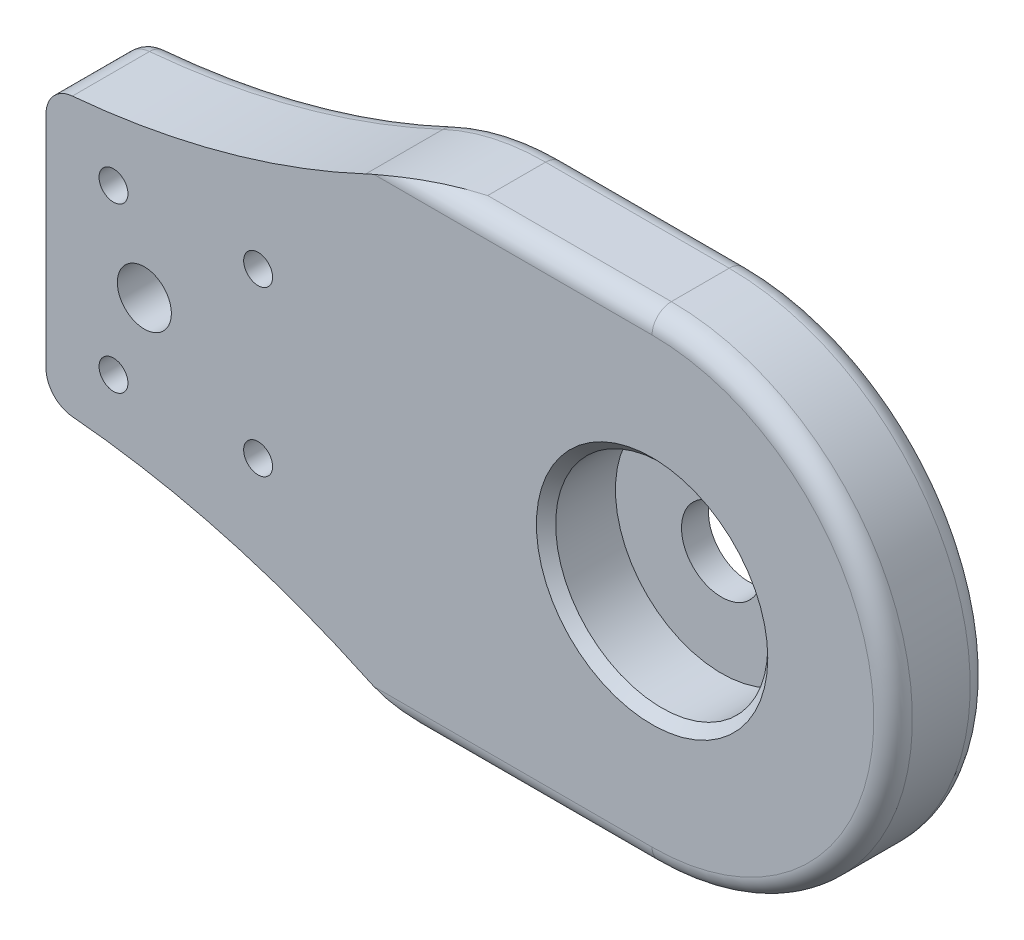
from build123d import *

# Parameters (mm, degrees)
SKETCH1_R           = 4.15
BOSS_EXTRUDE1_DEPTH = 10
SKETCH4_R           = 11
CUT_EXTRUDE2_DEPTH  = 7.2
CHAMFER1_SIZE       = 1
FILLET2_R           = 25
FILLET3_R           = 2
FILLET4_R           = 2
FILLET5_DEPTH       = 11
FILLET5_2_ANGLE     = 84.965742
FILLET5_3_ANGLE     = 84.965742
SKETCH5_R           = 2.8
CUT_EXTRUDE3_DEPTH  = 58.10630094
CUT_EXTRUDE5_DEPTH  = 4
SKETCH8_R           = 1.5
CUT_EXTRUDE6_DEPTH  = 58.10630094
SKETCH9_R           = 3.5
CUT_EXTRUDE7_DEPTH  = 3.4


with BuildPart() as part:
    # Sketch1 → Boss-Extrude1 (new body)
    with BuildSketch(Plane.XY):
        with BuildLine():
            Line((12.5, 25), (-12.5, 25))
            ThreePointArc((-12.5, 25), (-30.832208454, 17.504408525), (-50.36, 14.2))
            Line((-50.36, 14.2), (-50.36, -14.2))
            ThreePointArc((-50.36, -14.2), (-30.832208454, -17.504408525), (-12.5, -25))
            Line((-12.5, -25), (12.5, -25))
            ThreePointArc((12.5, -25), (37.5, 0), (12.5, 25))
        make_face()
        with Locations((12.5, 0)):
            Circle(SKETCH1_R, mode=Mode.SUBTRACT)
    extrude(amount=BOSS_EXTRUDE1_DEPTH)

    # Sketch4 → Cut-Extrude2 (cut)
    with BuildSketch(Plane.XY.offset(10)):
        with Locations((12.5, 0)):
            Circle(SKETCH4_R)
    extrude(amount=-CUT_EXTRUDE2_DEPTH, mode=Mode.SUBTRACT)

    # Chamfer1
    chamfer1_edges = [part.edges().sort_by_distance(p)[0] for p in [
        (1.5, 0, 10),
    ]]
    chamfer(chamfer1_edges, length=CHAMFER1_SIZE)

    # Fillet2
    fillet2_edges = [part.edges().sort_by_distance(p)[0] for p in [
        (-12.5, 25, 5),
        (-12.5, -25, 5),
    ]]
    fillet(fillet2_edges, radius=FILLET2_R)

    # Fillet3
    fillet3_edges = [part.edges().sort_by_distance(p)[0] for p in [
        (-33.37388042, 16.819399365, 0),
        (2.975273986, -25, 0),
        (-12.003831035, -24.397740667, 0),
        (-12.003831035, 24.397740667, 0),
        (-50.36, 0, 0),
        (2.975273986, 25, 0),
        (37.5, 0, 0),
        (-33.37388042, -16.819399365, 0),
    ]]
    fillet(fillet3_edges, radius=FILLET3_R)

    # Fillet4
    # the kernel refuses this fillet: 2 mm, written as the material it takes off along each edge
    with BuildSketch(Plane(origin=(12.5, 0, 10), x_dir=(0, -1, 0), z_dir=(-1, 0, 0))) as fillet4_piece_1:
        with BuildLine():
            CenterArc((25 - FILLET4_R, -FILLET4_R), FILLET4_R, 0, 90)
            Line((25, -FILLET4_R), (25, 0))
            Line((25, 0), (25 - FILLET4_R, 0))
        make_face()
    revolve(axis=Axis((12.5, 0, 10), (0, 0, 1)), revolution_arc=180, mode=Mode.SUBTRACT)
    with BuildSketch(Plane(origin=(12.5, 25, 10), x_dir=(0, -1, 0), z_dir=(-1, 0, 0))) as fillet4_piece_2:
        with BuildLine():
            CenterArc((FILLET4_R, -FILLET4_R), FILLET4_R, 90, 90)
            Line((0, -FILLET4_R), (0, 0))
            Line((0, 0), (FILLET4_R, 0))
        make_face()
    extrude(amount=34.049452029, mode=Mode.SUBTRACT)
    with BuildSketch(Plane(origin=(-21.549452029, -25, 10), x_dir=(0, 0, -1), z_dir=(1, 0, 0))) as fillet4_piece_3:
        with BuildLine():
            CenterArc((FILLET4_R, FILLET4_R), FILLET4_R, 180, 90)
            Line((0, FILLET4_R), (0, 0))
            Line((0, 0), (FILLET4_R, 0))
        make_face()
    extrude(amount=34.049452029, mode=Mode.SUBTRACT)

    # Fillet5: read off the stored shape, not the designer's step
    # Fillet5 outline → Fillet5 (cut)
    with BuildSketch(Plane.XY):
        with BuildLine():
            Line((-50.36, 14.2), (-50.36, 11.410663893))
            ThreePointArc((-50.36, 11.410663893), (-49.572437829, 13.436773182), (-47.623254098, 14.399091118))
            ThreePointArc((-47.623254098, 14.399091118), (-48.990868253, 14.289114994), (-50.36, 14.2))
        make_face()
        with BuildLine():
            ThreePointArc((-47.623254098, -14.399091118), (-49.572437829, -13.436773182), (-50.36, -11.410663893))
            Line((-50.36, -11.410663893), (-50.36, -14.2))
            ThreePointArc((-50.36, -14.2), (-48.990868253, -14.289114994), (-47.623254098, -14.399091118))
        make_face()
    extrude(amount=FILLET5_DEPTH, mode=Mode.SUBTRACT)

    # Fillet5 2 outline → Fillet5 2 (revolve, cut)
    with BuildSketch(Plane(origin=(-47.36, 11.410663893, 0), x_dir=(-0.08775136609960318, 0.9961424083672241, 0), z_dir=(0.9961424083672241, 0.08775136609960318, 0))):
        with BuildLine():
            ThreePointArc((3, 2), (2.414213562, 0.585786438), (1, 0))
            Line((1, 0), (3, 0))
            Line((3, 0), (3, 2))
        make_face()
    revolve(axis=Axis((-47.36, 11.410663893, 0), (0, 0, 1)), revolution_arc=FILLET5_2_ANGLE, mode=Mode.SUBTRACT)

    # Fillet5 3 outline → Fillet5 3 (revolve, cut)
    with BuildSketch(Plane(origin=(-47.36, -11.410663893, 0), x_dir=(-1, 0, 0), z_dir=(0, 1, 0))):
        with BuildLine():
            ThreePointArc((3, 2), (2.414213562, 0.585786438), (1, 0))
            Line((1, 0), (3, 0))
            Line((3, 0), (3, 2))
        make_face()
    revolve(axis=Axis((-47.36, -11.410663893, 0), (0, 0, 1)), revolution_arc=FILLET5_3_ANGLE, mode=Mode.SUBTRACT)

    # Sketch5 → Cut-Extrude3 (cut, through all)
    with BuildSketch(Plane(origin=(0, 0, 0), x_dir=(-1, 0, 0), z_dir=(0, 0, -1))):
        with Locations((40.16, 0)):
            Circle(SKETCH5_R)
    extrude(amount=-CUT_EXTRUDE3_DEPTH, mode=Mode.SUBTRACT)

    # Sketch7 → Cut-Extrude5 (cut)
    with BuildSketch(Plane(origin=(0, 0, 0), x_dir=(-1, 0, 0), z_dir=(0, 0, -1))):
        Polygon((36.16, -2.309401077), (40.16, -4.618802154), (44.16, -2.309401077), (44.16, 2.309401077), (40.16, 4.618802154), (36.16, 2.309401077), align=None)
    extrude(amount=-CUT_EXTRUDE5_DEPTH, mode=Mode.SUBTRACT)

    # Sketch8 → Cut-Extrude6 (cut, through all)
    with BuildSketch(Plane(origin=(0, 0, 0), x_dir=(-1, 0, 0), z_dir=(0, 0, -1))):
        with Locations((43.36, -8.5)):
            Circle(SKETCH8_R)
        with Locations((28.36, -8.5)):
            Circle(SKETCH8_R)
        with Locations(Location((28.36, 8.5, 0), (0, 0, 180))):
            Circle(SKETCH8_R)
        with Locations(Location((43.36, 8.5, 0), (0, 0, 180))):
            Circle(SKETCH8_R)
    extrude(amount=-CUT_EXTRUDE6_DEPTH, mode=Mode.SUBTRACT)

    # Sketch9 → Cut-Extrude7 (cut)
    with BuildSketch(Plane(origin=(0, 0, 0), x_dir=(-1, 0, 0), z_dir=(0, 0, -1))):
        with Locations((43.36, -8.5)):
            Circle(SKETCH9_R)
        with Locations((28.36, -8.5)):
            Circle(SKETCH9_R)
        with Locations(Location((28.36, 8.5, 0), (0, 0, 180))):
            Circle(SKETCH9_R)
        with Locations(Location((43.36, 8.5, 0), (0, 0, 180))):
            Circle(SKETCH9_R)
    extrude(amount=-CUT_EXTRUDE7_DEPTH, mode=Mode.SUBTRACT)


solid = part.part
